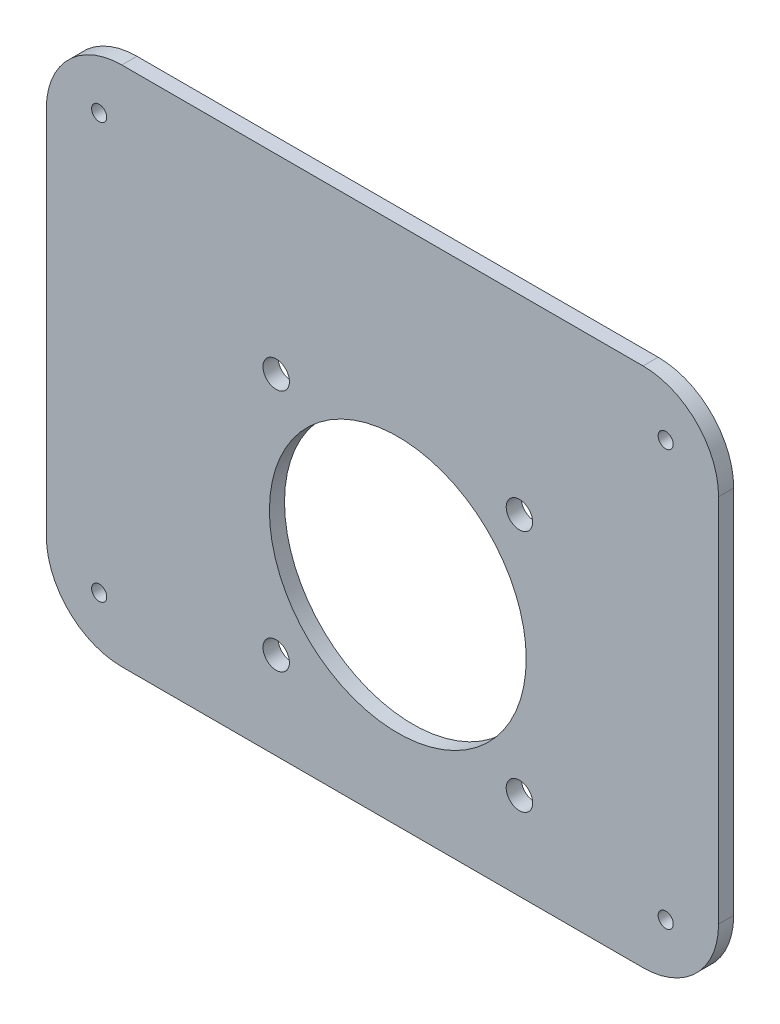
from build123d import *

# Parameters (mm, degrees)
SKETCH_1_R          = 1
EXTRUDE_1_DEPTH     = 2
CUT_EXTRUDE_1_REACH = 114.632
SKETCH_2_R          = 1.75
SKETCH_2_R_2        = 17


with BuildPart() as part:
    # 草图1 → 凸台-拉伸1 (new body)
    with BuildSketch(Plane.XY):
        with BuildLine():
            ThreePointArc((10, 0), (2.928932188, -2.928932188), (0, -10))
            Line((0, -10), (0, -59))
            ThreePointArc((0, -59), (2.928932188, -66.071067812), (10, -69))
            Line((10, -69), (79, -69))
            ThreePointArc((79, -69), (86.071067812, -66.071067812), (89, -59))
            Line((89, -59), (89, -10))
            ThreePointArc((89, -10), (86.071067812, -2.928932188), (79, 0))
            Line((79, 0), (10, 0))
        make_face()
        with Locations((7, -7)):
            Circle(SKETCH_1_R, mode=Mode.SUBTRACT)
        with Locations((82, -7)):
            Circle(SKETCH_1_R, mode=Mode.SUBTRACT)
        with Locations((7, -62)):
            Circle(SKETCH_1_R, mode=Mode.SUBTRACT)
        with Locations((82, -62)):
            Circle(SKETCH_1_R, mode=Mode.SUBTRACT)
    extrude(amount=-EXTRUDE_1_DEPTH)

    # 草图2 → 切除-拉伸1 (cut, up to next)
    with BuildSketch(Plane.XY, mode=Mode.PRIVATE) as cut_extrude_1_sk1:
        with Locations((30.433894266, -25.230754204)):
            Circle(SKETCH_2_R)
    cut_extrude_1_tool1 = extrude(cut_extrude_1_sk1.sketch, amount=-CUT_EXTRUDE_1_REACH, mode=Mode.PRIVATE) & part.part
    # 草图2 → 切除-拉伸1 (cut, up to next)
    with BuildSketch(Plane.XY, mode=Mode.PRIVATE) as cut_extrude_1_sk2:
        with Locations((62.633894266, -25.230754204)):
            Circle(SKETCH_2_R)
    cut_extrude_1_tool2 = extrude(cut_extrude_1_sk2.sketch, amount=-CUT_EXTRUDE_1_REACH, mode=Mode.PRIVATE) & part.part
    # 草图2 → 切除-拉伸1 (cut, up to next)
    with BuildSketch(Plane.XY, mode=Mode.PRIVATE) as cut_extrude_1_sk3:
        with Locations((46.533894266, -41.330754204)):
            Circle(SKETCH_2_R_2)
    cut_extrude_1_tool3 = extrude(cut_extrude_1_sk3.sketch, amount=-CUT_EXTRUDE_1_REACH, mode=Mode.PRIVATE) & part.part
    # 草图2 → 切除-拉伸1 (cut, up to next)
    with BuildSketch(Plane.XY, mode=Mode.PRIVATE) as cut_extrude_1_sk4:
        with Locations((30.433894266, -57.430754204)):
            Circle(SKETCH_2_R)
    cut_extrude_1_tool4 = extrude(cut_extrude_1_sk4.sketch, amount=-CUT_EXTRUDE_1_REACH, mode=Mode.PRIVATE) & part.part
    # 草图2 → 切除-拉伸1 (cut, up to next)
    with BuildSketch(Plane.XY, mode=Mode.PRIVATE) as cut_extrude_1_sk5:
        with Locations((62.633894266, -57.430754204)):
            Circle(SKETCH_2_R)
    cut_extrude_1_tool5 = extrude(cut_extrude_1_sk5.sketch, amount=-CUT_EXTRUDE_1_REACH, mode=Mode.PRIVATE) & part.part
    add(cut_extrude_1_tool1.solids().sort_by_distance((30.433894, -25.230754, 0))[0], mode=Mode.SUBTRACT)
    add(cut_extrude_1_tool2.solids().sort_by_distance((62.633894, -25.230754, 0))[0], mode=Mode.SUBTRACT)
    add(cut_extrude_1_tool3.solids().sort_by_distance((46.533894, -41.330754, 0))[0], mode=Mode.SUBTRACT)
    add(cut_extrude_1_tool4.solids().sort_by_distance((30.433894, -57.430754, 0))[0], mode=Mode.SUBTRACT)
    add(cut_extrude_1_tool5.solids().sort_by_distance((62.633894, -57.430754, 0))[0], mode=Mode.SUBTRACT)


solid = part.part
